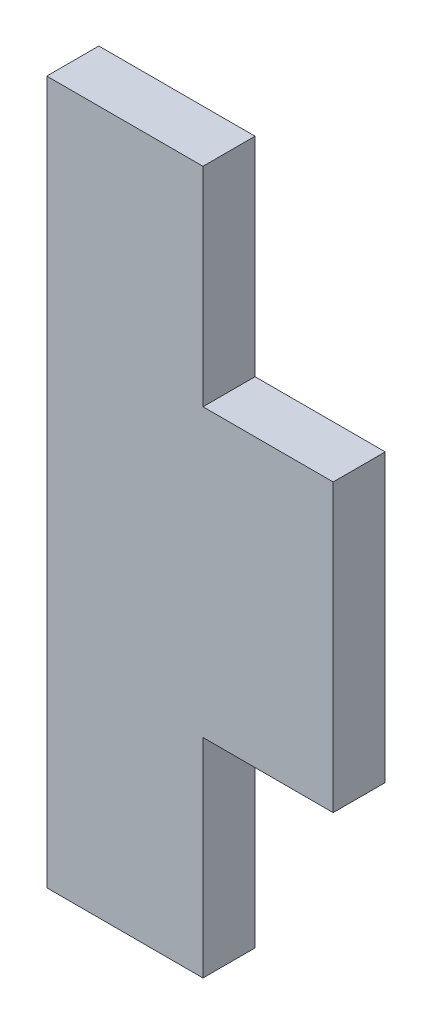
from build123d import *

# Parameters (mm, degrees)
BOSS_EXTRUDE9_DEPTH = 10


with BuildPart() as part:
    # Sketch4 → Boss-Extrude9 (new body)
    with BuildSketch(Plane.XY):
        Polygon((-31.951285484, 58.173047074), (-1.951285484, 58.173047074), (-1.951285484, 18.173047074), (23.048714516, 18.173047074), (23.048714516, -36.826952926), (-1.951285484, -36.826952926), (-1.951285484, -76.826952926), (-31.951285484, -76.826952926), align=None)
    extrude(amount=BOSS_EXTRUDE9_DEPTH)


solid = part.part
